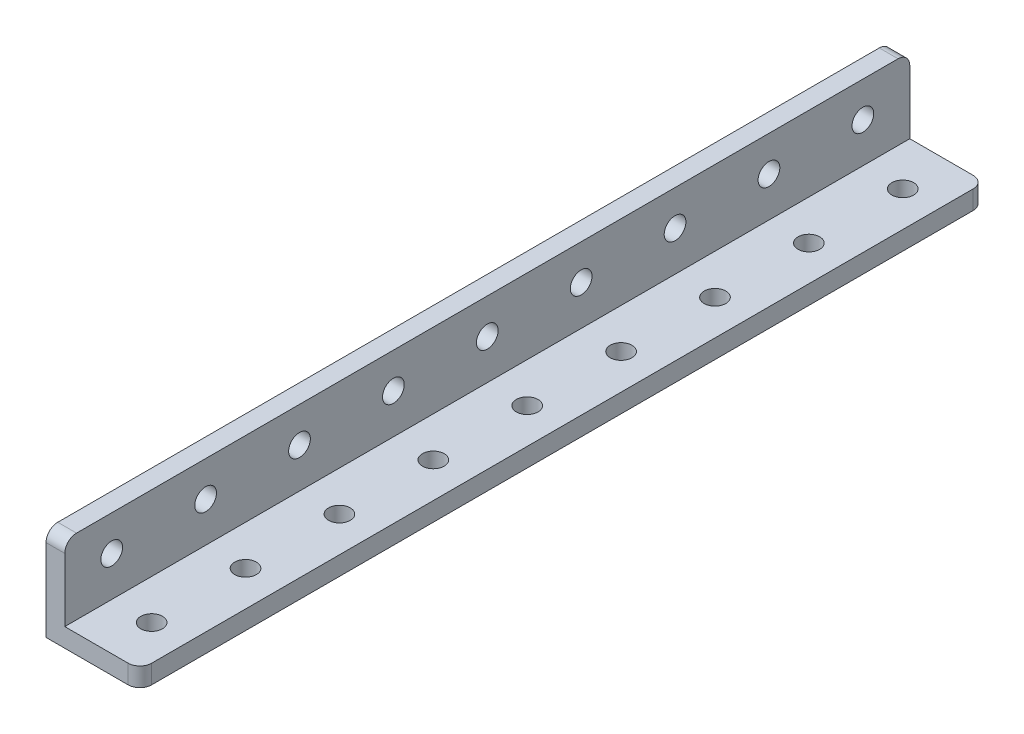
from build123d import *

# Parameters (mm, degrees)
BOSS_EXTRUDE1_DEPTH = 72
SKETCH2_R           = 1.85
CUT_EXTRUDE1_DEPTH  = 76.471849056
CUT_EXTRUDE2_REACH  = 76.859
SKETCH3_R           = 1.85
LPATTERN1_COUNT     = 9
LPATTERN1_PITCH     = 16
FILLET1_R           = 2


with BuildPart() as part:
    # Sketch1 → Boss-Extrude1 (new, symmetric)
    with BuildSketch(Plane.XY):
        Polygon((0, 0), (16, 0), (16, 3.2), (3.2, 3.2), (3.2, 16), (0, 16), align=None)
    extrude(amount=BOSS_EXTRUDE1_DEPTH, both=True)

    # Sketch2 → Cut-Extrude1 (cut, through all)
    with BuildSketch(Plane.ZY):
        with Locations((64, 10)):
            Circle(SKETCH2_R)
    cut_extrude1 = extrude(amount=-CUT_EXTRUDE1_DEPTH, mode=Mode.SUBTRACT)

    # Sketch3 → Cut-Extrude2 (cut, up to next)
    with BuildSketch(Plane(origin=(0, 3.2, 0), x_dir=(1, 0, 0), z_dir=(0, 1, 0)), mode=Mode.PRIVATE) as cut_extrude2_sk1:
        with Locations((10, -64)):
            Circle(SKETCH3_R)
    cut_extrude2_tool1 = extrude(cut_extrude2_sk1.sketch, amount=-CUT_EXTRUDE2_REACH, mode=Mode.PRIVATE) & part.part
    cut_extrude2 = cut_extrude2_tool1.solids().sort_by_distance((10, 3.2, 64))[0]
    add(cut_extrude2, mode=Mode.SUBTRACT)

    # LPattern1: Cut-Extrude1, Cut-Extrude2 ×9
    with Locations(*[(0, 0, -i * LPATTERN1_PITCH) for i in range(1, LPATTERN1_COUNT)]):
        add(cut_extrude1, mode=Mode.SUBTRACT)
        add(cut_extrude2, mode=Mode.SUBTRACT)

    # Fillet1
    fillet1_edges = [part.edges().sort_by_distance(p)[0] for p in [
        (1.6, 16, 72),
        (16, 1.6, 72),
        (16, 1.6, -72),
        (1.6, 16, -72),
    ]]
    fillet(fillet1_edges, radius=FILLET1_R)


solid = part.part
